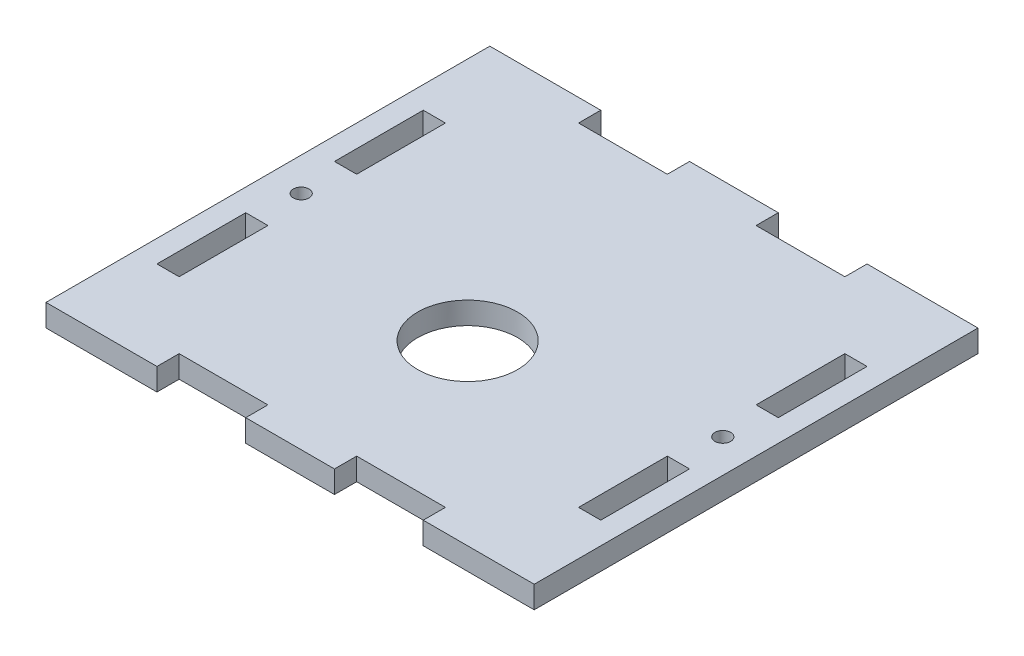
from build123d import *

# Parameters (mm, degrees)
SKETCH1_W                 = 139.7
SKETCH1_H                 = 127
BOSS_EXTRUDE1_DEPTH       = 6.35
SKETCH13_W                = 25.4
SKETCH13_H                = 6.35
CUT_EXTRUDE6_DEPTH        = 6.35
LPATTERN7_COUNT           = 2
LPATTERN7_PITCH           = 120.65
SKETCH14_W                = 6.35
SKETCH14_H                = 25.4
CUT_EXTRUDE7_DEPTH        = 6.35
F_8_CLEARANCE_HOLE1_D     = 4.4958
F_8_CLEARANCE_HOLE1_DEPTH = 10.16
F_8_CLEARANCE_HOLE1_TIP   = 1.350674586
SKETCH18_R                = 14.2875
CUT_EXTRUDE9_DEPTH        = 7.62


with BuildPart() as part:
    # Sketch1 → Boss-Extrude1 (new body)
    with BuildSketch(Plane(origin=(0, 0, 0), x_dir=(1, 0, 0), z_dir=(0, 1, 0))):
        with Locations((69.85, 63.5)):
            Rectangle(SKETCH1_W, SKETCH1_H)
    extrude(amount=BOSS_EXTRUDE1_DEPTH)

    # Sketch13 → Cut-Extrude6 (cut)
    with BuildSketch(Plane(origin=(0, 6.35, 0), x_dir=(1, 0, 0), z_dir=(0, 1, 0))):
        with Locations((44.45, 3.175)):
            Rectangle(SKETCH13_W, SKETCH13_H)
        with Locations((95.25, 3.175)):
            Rectangle(SKETCH13_W, SKETCH13_H)
    cut_extrude6 = extrude(amount=-CUT_EXTRUDE6_DEPTH, mode=Mode.SUBTRACT)

    # LPattern7: Cut-Extrude6 ×2
    with Locations(*[(0, 0, -i * LPATTERN7_PITCH) for i in range(1, LPATTERN7_COUNT)]):
        add(cut_extrude6, mode=Mode.SUBTRACT)

    # Sketch14 → Cut-Extrude7 (cut)
    with BuildSketch(Plane(origin=(0, 6.35, 0), x_dir=(1, 0, 0), z_dir=(0, 1, 0))):
        with Locations((9.525, 38.1)):
            Rectangle(SKETCH14_W, SKETCH14_H)
        with Locations((130.175, 38.1)):
            Rectangle(SKETCH14_W, SKETCH14_H)
        with Locations((130.175, 88.9)):
            Rectangle(SKETCH14_W, SKETCH14_H)
        with Locations((9.525, 88.9)):
            Rectangle(SKETCH14_W, SKETCH14_H)
    extrude(amount=-CUT_EXTRUDE7_DEPTH, mode=Mode.SUBTRACT)

    # #8 Clearance Hole1
    with Locations(Plane(origin=(0, 6.35, 0), x_dir=(1, 0, 0), z_dir=(0, 1, 0))):
        with Locations((9.525, 63.5), (130.175, 63.5)):
            Hole(F_8_CLEARANCE_HOLE1_D / 2, depth=F_8_CLEARANCE_HOLE1_DEPTH)
            with Locations((0, 0, -(F_8_CLEARANCE_HOLE1_DEPTH + F_8_CLEARANCE_HOLE1_TIP / 2))):  # 118° drill point
                Cone(0, F_8_CLEARANCE_HOLE1_D / 2, F_8_CLEARANCE_HOLE1_TIP, mode=Mode.SUBTRACT)

    # Sketch18 → Cut-Extrude9 (cut)
    with BuildSketch(Plane(origin=(0, 6.35, 0), x_dir=(1, 0, 0), z_dir=(0, 1, 0))):
        with Locations((69.85, 50.8)):
            Circle(SKETCH18_R)
    extrude(amount=-CUT_EXTRUDE9_DEPTH, mode=Mode.SUBTRACT)


solid = part.part
